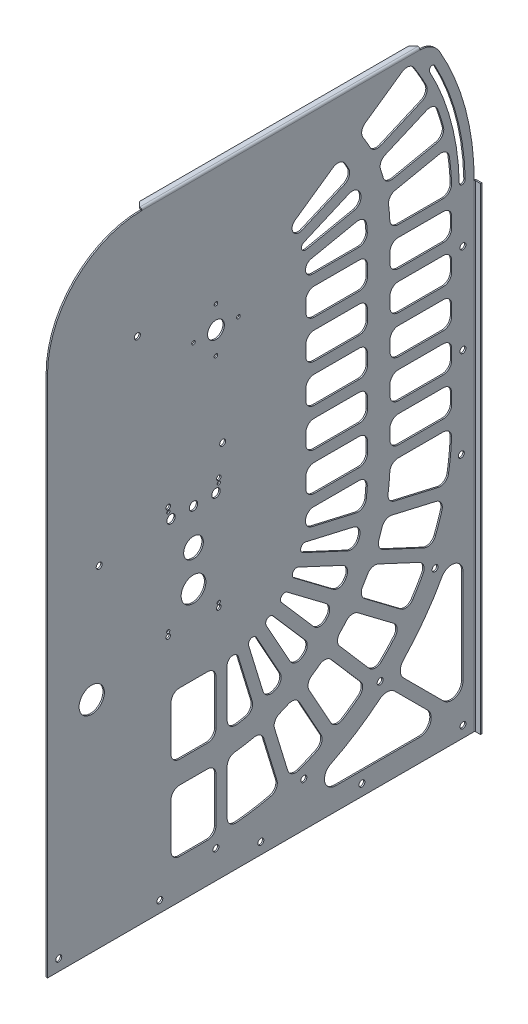
from build123d import *

# Parameters (mm, degrees)
SKETCH1_W             = 482.6
SKETCH1_H             = 698.5
BASE_FLANGE1_DEPTH    = 1.5875
SKETCH7_R             = 9.525
BEARING_HOLES_DEPTH   = 850.003845784
SKETCH9_R             = 3.3782
CUT_EXTRUDE2_DEPTH    = 850.003845784
CRVPATTERN1_START     = -1.5875
CRVPATTERN1_OUTLINE_R = 3.3782
CRVPATTERN1_DEPTH     = 1.5875
CUT_EXTRUDE3_DEPTH    = 850.003845784
CUT_EXTRUDE4_REACH    = 851.004
SKETCH12_R            = 4.7625
SKETCH13_R            = 3.3782
CUT_EXTRUDE5_DEPTH    = 850.003845784
CUT_EXTRUDE7_DEPTH    = 2.54
FILLET1_R             = 25.4
FILLET2_R             = 106.68
SKETCH26_R            = 3.3782
CUT_EXTRUDE9_DEPTH    = 850.003845784
CUT_EXTRUDE8_DEPTH    = 850.003845784
EDGE_FLANGE2_DEPTH    = 539.75
CUT_EXTRUDE10_DEPTH   = 850.039465459
SKETCH28_R            = 14.2875
CUT_EXTRUDE11_DEPTH   = 850.039465459
EDGE_FLANGE3_DEPTH    = 314.788975189
BREAK_CORNER1_START   = 699.2366
BREAK_CORNER1_DEPTH   = 1.5875


# Read off the part's stored shape, not the designer's step: CrvPattern1, Break-Corner1
# Sheet-metal steps are written as plain solids
with BuildPart() as part:
    # Sketch1 → Base-Flange1 (new body)
    with BuildSketch(Plane(origin=(0, 0, 0), x_dir=(0, 0, -1), z_dir=(1, 0, 0))):
        with Locations((-241.3, 349.25)):
            Rectangle(SKETCH1_W, SKETCH1_H)
    extrude(amount=-BASE_FLANGE1_DEPTH)

    # Sketch7 → Bearing Holes (cut, through all)
    with BuildSketch(Plane(origin=(0, 0, 0), x_dir=(0, 0, -1), z_dir=(1, 0, 0))):
        with Locations((-292.1, 539.75)):
            Circle(SKETCH7_R)
        with BuildLine():
            ThreePointArc((-315.4807, 539.75), (-317.5, 541.7693), (-319.5193, 539.75))
            ThreePointArc((-319.5193, 539.75), (-317.5, 537.7307), (-315.4807, 539.75))
        make_face()
        with BuildLine():
            ThreePointArc((-294.1193, 514.35), (-292.1, 512.3307), (-290.0807, 514.35))
            ThreePointArc((-290.0807, 514.35), (-292.1, 516.3693), (-294.1193, 514.35))
        make_face()
        with BuildLine():
            ThreePointArc((-268.7193, 539.75), (-266.7, 537.7307), (-264.6807, 539.75))
            ThreePointArc((-264.6807, 539.75), (-266.7, 541.7693), (-268.7193, 539.75))
        make_face()
        with BuildLine():
            ThreePointArc((-294.1193, 565.15), (-292.1, 563.1307), (-290.0807, 565.15))
            ThreePointArc((-290.0807, 565.15), (-292.1, 567.1693), (-294.1193, 565.15))
        make_face()
    extrude(amount=-BEARING_HOLES_DEPTH, mode=Mode.SUBTRACT)

    # Sketch9 → Cut-Extrude2 (cut, through all)
    with BuildSketch(Plane(origin=(0, 0, 0), x_dir=(0, 0, -1), z_dir=(1, 0, 0))):
        with Locations((-292.1, 31.75)):
            Circle(SKETCH9_R)
    extrude(amount=-CUT_EXTRUDE2_DEPTH, mode=Mode.SUBTRACT)

    # CrvPattern1 outline → CrvPattern1 (cut)
    with BuildSketch(Plane.YZ.offset(CRVPATTERN1_START)):
        with Locations((481.869506294, 12.7)):
            Circle(CRVPATTERN1_OUTLINE_R)
        with Locations((380.269506294, 12.7)):
            Circle(CRVPATTERN1_OUTLINE_R)
        with Locations((278.74261521, 14.58581764)):
            Circle(CRVPATTERN1_OUTLINE_R)
        with Locations((182.156845096, 44.259071201)):
            Circle(CRVPATTERN1_OUTLINE_R)
        with Locations((102.440892256, 106.345139108)):
            Circle(CRVPATTERN1_OUTLINE_R)
        with Locations((50.020066151, 192.724360892)):
            Circle(CRVPATTERN1_OUTLINE_R)
    extrude(amount=CRVPATTERN1_DEPTH, mode=Mode.SUBTRACT)

    # Sketch11 → Cut-Extrude3 (cut, through all)
    with BuildSketch(Plane(origin=(0, 0, 0), x_dir=(0, 0, -1), z_dir=(1, 0, 0))):
        with BuildLine():
            ThreePointArc((-10.148177306, 546.176984789), (-19.619450406, 612.499477987), (-44.466941645, 674.716680569))
            ThreePointArc((-44.466941645, 674.716680569), (-49.04986212, 676.066239905), (-50.399421456, 671.483319431))
            ThreePointArc((-50.399421456, 671.483319431), (-26.147195006, 610.756637946), (-16.902822694, 546.023015211))
            ThreePointArc((-16.902822694, 546.023015211), (-13.448515211, 542.722677306), (-10.148177306, 546.176984789))
        make_face()
    extrude(amount=-CUT_EXTRUDE3_DEPTH, mode=Mode.SUBTRACT)

    # Sketch12 → Cut-Extrude4 (cut, up to next)
    with BuildSketch(Plane(origin=(0, 0, 0), x_dir=(0, 0, -1), z_dir=(1, 0, 0)), mode=Mode.PRIVATE) as cut_extrude4_sk1:
        with Locations((-342.9, 379.8824)):
            Circle(SKETCH12_R)
    cut_extrude4_tool1 = extrude(cut_extrude4_sk1.sketch, amount=-CUT_EXTRUDE4_REACH, mode=Mode.PRIVATE) & part.part
    # Sketch12 → Cut-Extrude4 (cut, up to next)
    with BuildSketch(Plane(origin=(0, 0, 0), x_dir=(0, 0, -1), z_dir=(1, 0, 0)), mode=Mode.PRIVATE) as cut_extrude4_sk2:
        with Locations((-292.1, 379.8824)):
            Circle(SKETCH12_R)
    cut_extrude4_tool2 = extrude(cut_extrude4_sk2.sketch, amount=-CUT_EXTRUDE4_REACH, mode=Mode.PRIVATE) & part.part
    # Sketch12 → Cut-Extrude4 (cut, up to next)
    with BuildSketch(Plane(origin=(0, 0, 0), x_dir=(0, 0, -1), z_dir=(1, 0, 0)), mode=Mode.PRIVATE) as cut_extrude4_sk3:
        with Locations((-317.5, 379.8824)):
            Circle(SKETCH12_R)
    cut_extrude4_tool3 = extrude(cut_extrude4_sk3.sketch, amount=-CUT_EXTRUDE4_REACH, mode=Mode.PRIVATE) & part.part
    # Sketch12 → Cut-Extrude4 (cut, up to next)
    with BuildSketch(Plane(origin=(0, 0, 0), x_dir=(0, 0, -1), z_dir=(1, 0, 0)), mode=Mode.PRIVATE) as cut_extrude4_sk4:
        with BuildLine():
            ThreePointArc((-347.896015918, 388.0612), (-346.075, 386.240184083), (-344.253984083, 388.0612))
            ThreePointArc((-344.253984083, 388.0612), (-346.075, 389.882215918), (-347.896015918, 388.0612))
        make_face()
    cut_extrude4_tool4 = extrude(cut_extrude4_sk4.sketch, amount=-CUT_EXTRUDE4_REACH, mode=Mode.PRIVATE) & part.part
    # Sketch12 → Cut-Extrude4 (cut, up to next)
    with BuildSketch(Plane(origin=(0, 0, 0), x_dir=(0, 0, -1), z_dir=(1, 0, 0)), mode=Mode.PRIVATE) as cut_extrude4_sk5:
        with BuildLine():
            ThreePointArc((-348.6277, 393.1412), (-346.075, 390.5885), (-343.5223, 393.1412))
            ThreePointArc((-343.5223, 393.1412), (-346.075, 395.6939), (-348.6277, 393.1412))
        make_face()
    cut_extrude4_tool5 = extrude(cut_extrude4_sk5.sketch, amount=-CUT_EXTRUDE4_REACH, mode=Mode.PRIVATE) & part.part
    # Sketch12 → Cut-Extrude4 (cut, up to next)
    with BuildSketch(Plane(origin=(0, 0, 0), x_dir=(0, 0, -1), z_dir=(1, 0, 0)), mode=Mode.PRIVATE) as cut_extrude4_sk6:
        with BuildLine():
            ThreePointArc((-344.253984082, 271.2212), (-346.075, 273.042215918), (-347.896015918, 271.2212))
            ThreePointArc((-347.896015918, 271.2212), (-346.075, 269.400184083), (-344.253984082, 271.2212))
        make_face()
    cut_extrude4_tool6 = extrude(cut_extrude4_sk6.sketch, amount=-CUT_EXTRUDE4_REACH, mode=Mode.PRIVATE) & part.part
    # Sketch12 → Cut-Extrude4 (cut, up to next)
    with BuildSketch(Plane(origin=(0, 0, 0), x_dir=(0, 0, -1), z_dir=(1, 0, 0)), mode=Mode.PRIVATE) as cut_extrude4_sk7:
        with BuildLine():
            ThreePointArc((-343.5223, 266.1412), (-346.075, 268.6939), (-348.6277, 266.1412))
            ThreePointArc((-348.6277, 266.1412), (-346.075, 263.5885), (-343.5223, 266.1412))
        make_face()
    cut_extrude4_tool7 = extrude(cut_extrude4_sk7.sketch, amount=-CUT_EXTRUDE4_REACH, mode=Mode.PRIVATE) & part.part
    # Sketch12 → Cut-Extrude4 (cut, up to next)
    with BuildSketch(Plane(origin=(0, 0, 0), x_dir=(0, 0, -1), z_dir=(1, 0, 0)), mode=Mode.PRIVATE) as cut_extrude4_sk8:
        with BuildLine():
            ThreePointArc((-287.103984082, 271.2212), (-288.925, 273.042215918), (-290.746015918, 271.2212))
            ThreePointArc((-290.746015918, 271.2212), (-288.925, 269.400184083), (-287.103984082, 271.2212))
        make_face()
    cut_extrude4_tool8 = extrude(cut_extrude4_sk8.sketch, amount=-CUT_EXTRUDE4_REACH, mode=Mode.PRIVATE) & part.part
    # Sketch12 → Cut-Extrude4 (cut, up to next)
    with BuildSketch(Plane(origin=(0, 0, 0), x_dir=(0, 0, -1), z_dir=(1, 0, 0)), mode=Mode.PRIVATE) as cut_extrude4_sk9:
        with BuildLine():
            ThreePointArc((-291.4777, 266.1412), (-288.925, 263.5885), (-286.3723, 266.1412))
            ThreePointArc((-286.3723, 266.1412), (-288.925, 268.6939), (-291.4777, 266.1412))
        make_face()
    cut_extrude4_tool9 = extrude(cut_extrude4_sk9.sketch, amount=-CUT_EXTRUDE4_REACH, mode=Mode.PRIVATE) & part.part
    # Sketch12 → Cut-Extrude4 (cut, up to next)
    with BuildSketch(Plane(origin=(0, 0, 0), x_dir=(0, 0, -1), z_dir=(1, 0, 0)), mode=Mode.PRIVATE) as cut_extrude4_sk10:
        with BuildLine():
            ThreePointArc((-286.3723, 393.1412), (-288.925, 395.6939), (-291.4777, 393.1412))
            ThreePointArc((-291.4777, 393.1412), (-288.925, 390.5885), (-286.3723, 393.1412))
        make_face()
    cut_extrude4_tool10 = extrude(cut_extrude4_sk10.sketch, amount=-CUT_EXTRUDE4_REACH, mode=Mode.PRIVATE) & part.part
    # Sketch12 → Cut-Extrude4 (cut, up to next)
    with BuildSketch(Plane(origin=(0, 0, 0), x_dir=(0, 0, -1), z_dir=(1, 0, 0)), mode=Mode.PRIVATE) as cut_extrude4_sk11:
        with BuildLine():
            ThreePointArc((-290.746015918, 388.0612), (-288.925, 386.240184083), (-287.103984083, 388.0612))
            ThreePointArc((-287.103984083, 388.0612), (-288.925, 389.882215918), (-290.746015918, 388.0612))
        make_face()
    cut_extrude4_tool11 = extrude(cut_extrude4_sk11.sketch, amount=-CUT_EXTRUDE4_REACH, mode=Mode.PRIVATE) & part.part
    # Sketch12 → Cut-Extrude4 (cut, up to next)
    with BuildSketch(Plane(origin=(0, 0, 0), x_dir=(0, 0, -1), z_dir=(1, 0, 0)), mode=Mode.PRIVATE) as cut_extrude4_sk12:
        with BuildLine():
            ThreePointArc((-303.576766112, 297.307871241), (-316.357871241, 312.373233888), (-331.423233888, 299.592128759))
            ThreePointArc((-331.423233888, 299.592128759), (-318.642128759, 284.526766112), (-303.576766112, 297.307871241))
        make_face()
    cut_extrude4_tool12 = extrude(cut_extrude4_sk12.sketch, amount=-CUT_EXTRUDE4_REACH, mode=Mode.PRIVATE) & part.part
    # Sketch12 → Cut-Extrude4 (cut, up to next)
    with BuildSketch(Plane(origin=(0, 0, 0), x_dir=(0, 0, -1), z_dir=(1, 0, 0)), mode=Mode.PRIVATE) as cut_extrude4_sk13:
        with BuildLine():
            ThreePointArc((-328.448691084, 341.081764815), (-319.415564815, 328.217508917), (-306.551308917, 337.250635185))
            ThreePointArc((-306.551308917, 337.250635185), (-315.584435185, 350.114891084), (-328.448691084, 341.081764815))
        make_face()
    cut_extrude4_tool13 = extrude(cut_extrude4_sk13.sketch, amount=-CUT_EXTRUDE4_REACH, mode=Mode.PRIVATE) & part.part
    add(cut_extrude4_tool1.solids().sort_by_distance((0, 379.8824, 342.9))[0], mode=Mode.SUBTRACT)
    add(cut_extrude4_tool2.solids().sort_by_distance((0, 379.8824, 292.1))[0], mode=Mode.SUBTRACT)
    add(cut_extrude4_tool3.solids().sort_by_distance((0, 379.8824, 317.5))[0], mode=Mode.SUBTRACT)
    add(cut_extrude4_tool4.solids().sort_by_distance((0, 388.0612, 346.075))[0], mode=Mode.SUBTRACT)
    add(cut_extrude4_tool5.solids().sort_by_distance((0, 393.1412, 346.075))[0], mode=Mode.SUBTRACT)
    add(cut_extrude4_tool6.solids().sort_by_distance((0, 271.2212, 346.075))[0], mode=Mode.SUBTRACT)
    add(cut_extrude4_tool7.solids().sort_by_distance((0, 266.1412, 346.075))[0], mode=Mode.SUBTRACT)
    add(cut_extrude4_tool8.solids().sort_by_distance((0, 271.2212, 288.925))[0], mode=Mode.SUBTRACT)
    add(cut_extrude4_tool9.solids().sort_by_distance((0, 266.1412, 288.925))[0], mode=Mode.SUBTRACT)
    add(cut_extrude4_tool10.solids().sort_by_distance((0, 393.1412, 288.925))[0], mode=Mode.SUBTRACT)
    add(cut_extrude4_tool11.solids().sort_by_distance((0, 388.0612, 288.925))[0], mode=Mode.SUBTRACT)
    add(cut_extrude4_tool12.solids().sort_by_distance((0, 298.45, 317.5))[0], mode=Mode.SUBTRACT)
    add(cut_extrude4_tool13.solids().sort_by_distance((0, 339.1662, 317.5))[0], mode=Mode.SUBTRACT)

    # Sketch13 → Cut-Extrude5 (cut, through all)
    with BuildSketch(Plane.ZY.offset(1.5875)):
        with Locations((381, 577.85)):
            Circle(SKETCH13_R)
        with Locations((284.48, 425.45)):
            Circle(SKETCH13_R)
        with Locations((424.18, 374.65)):
            Circle(SKETCH13_R)
    extrude(amount=-CUT_EXTRUDE5_DEPTH, mode=Mode.SUBTRACT)

    # Sketch18 → Cut-Extrude7 (cut)
    with BuildSketch(Plane(origin=(0, 0, 0), x_dir=(0, 0, -1), z_dir=(1, 0, 0))):
        with BuildLine():
            Line((-46.904470881, 698.5), (0, 698.5))
            Line((0, 698.5), (0, 539.75))
            ThreePointArc((0, 539.75), (-11.971436608, 622.517130989), (-46.904470881, 698.5))
        make_face()
    extrude(amount=-CUT_EXTRUDE7_DEPTH, mode=Mode.SUBTRACT)

    # Fillet1
    fillet1_edges = [part.edges().sort_by_distance(p)[0] for p in [
        (-0.79375, 698.5, 46.904470881),
    ]]
    fillet(fillet1_edges, radius=FILLET1_R)

    # Fillet2
    fillet2_edges = [part.edges().sort_by_distance(p)[0] for p in [
        (-0.79375, 698.5, 482.6),
    ]]
    fillet(fillet2_edges, radius=FILLET2_R)

    # Sketch26 → Cut-Extrude9 (cut, through all)
    with BuildSketch(Plane.ZY.offset(1.5875)):
        with Locations((12.7, 12.7)):
            Circle(SKETCH26_R)
        with Locations((127, 12.7)):
            Circle(SKETCH26_R)
        with Locations((241.3, 12.7)):
            Circle(SKETCH26_R)
        with Locations((355.6, 12.7)):
            Circle(SKETCH26_R)
        with Locations((469.9, 12.7)):
            Circle(SKETCH26_R)
    extrude(amount=-CUT_EXTRUDE9_DEPTH, mode=Mode.SUBTRACT)

    # Sketch19 → Cut-Extrude8 (cut, through all)
    with BuildSketch(Plane(origin=(0, 0, 0), x_dir=(0, 0, -1), z_dir=(1, 0, 0))):
        with BuildLine():
            Line((-156.649870801, 25.4), (-61.321024484, 25.4))
            ThreePointArc((-61.321024484, 25.4), (-49.587754421, 33.239920409), (-52.340768363, 47.080256121))
            Line((-52.340768363, 47.080256121), (-89.767936864, 84.507424621))
            ThreePointArc((-89.767936864, 84.507424621), (-98.124730264, 88.211855892), (-106.804518277, 85.34478648))
            ThreePointArc((-106.804518277, 85.34478648), (-133.53166182, 65.836950761), (-162.293626184, 49.477083333))
            ThreePointArc((-162.293626184, 49.477083333), (-169.014719331, 35.2016348), (-156.649870801, 25.4))
        make_face()
        with BuildLine():
            Line((-12.7, 163.589334509), (-12.7, 56.060512242))
            ThreePointArc((-12.7, 56.060512242), (-20.539920409, 44.327242179), (-34.380256121, 47.080256121))
            Line((-34.380256121, 47.080256121), (-79.827050366, 92.527050366))
            ThreePointArc((-79.827050366, 92.527050366), (-83.545642238, 101.336251972), (-80.065677818, 110.242418717))
            ThreePointArc((-80.065677818, 110.242418717), (-56.404297585, 138.610306414), (-36.5125, 169.737695572))
            ThreePointArc((-36.5125, 169.737695572), (-22.225, 175.886056634), (-12.7, 163.589334509))
        make_face()
    extrude(amount=-CUT_EXTRUDE8_DEPTH, mode=Mode.SUBTRACT)

    # Edge-Flange2 section (across the edge) → Edge-Flange2 (add)
    with BuildSketch(Plane(origin=(0, 0, -0.7366), x_dir=(0, 0, 1), z_dir=(0, 1, 0))):
        with BuildLine():
            Line((-1.5875, 0.7366), (-1.5875, 6.35))
            Line((-1.5875, 6.35), (0, 6.35))
            Line((0, 6.35), (0, 0.7366))
            ThreePointArc((0, 0.7366), (0.215745145, 0.215745145), (0.7366, 0))
            Line((0.7366, 0), (0.7366, -1.5875))
            ThreePointArc((0.7366, -1.5875), (-0.90678687, -0.90678687), (-1.5875, 0.7366))
        make_face()
    extrude(amount=EDGE_FLANGE2_DEPTH)

    # Sketch27 → Cut-Extrude10 (cut, through all)
    with BuildSketch(Plane.ZY.offset(1.5875)):
        with BuildLine():
            Line((333.375, 114.3), (301.625, 114.3))
            ThreePointArc((301.625, 114.3), (294.889807909, 111.510192091), (292.1, 104.775))
            Line((292.1, 104.775), (292.1, 53.975))
            ThreePointArc((292.1, 53.975), (294.889807909, 47.239807909), (301.625, 44.45))
            Line((301.625, 44.45), (333.375, 44.45))
            ThreePointArc((333.375, 44.45), (340.110192091, 47.239807909), (342.9, 53.975))
            Line((342.9, 53.975), (342.9, 104.775))
            ThreePointArc((342.9, 104.775), (340.110192091, 111.510192091), (333.375, 114.3))
        make_face()
        with BuildLine():
            Line((279.4, 54.937139277), (279.4, 105.975220848))
            ThreePointArc((279.4, 105.975220848), (276.963585082, 112.337420667), (270.900769231, 115.44482604))
            ThreePointArc((270.900769231, 115.44482604), (259.999148252, 116.935021646), (249.197819666, 119.032001305))
            ThreePointArc((249.197819666, 119.032001305), (242.329800372, 117.967696281), (238.013104914, 112.520809597))
            Line((238.013104914, 112.520809597), (223.125231873, 63.824771077))
            ThreePointArc((223.125231873, 63.824771077), (223.966051137, 56.31065229), (230.016776699, 51.776594685))
            ThreePointArc((230.016776699, 51.776594685), (249.416852344, 47.887699421), (269.051851852, 45.447774065))
            ThreePointArc((269.051851852, 45.447774065), (276.312590345, 47.916950137), (279.4, 54.937139277))
        make_face()
        with BuildLine():
            Line((210.980161472, 67.537891727), (225.868034514, 116.233930247))
            ThreePointArc((225.868034514, 116.233930247), (225.335192169, 123.163469428), (220.236497942, 127.886365932))
            ThreePointArc((220.236497942, 127.886365932), (215.184577357, 129.948619598), (210.191757295, 132.150105371))
            ThreePointArc((210.191757295, 132.150105371), (203.252539243, 132.53699947), (197.897702518, 128.10663178))
            Line((197.897702518, 128.10663178), (173.210689518, 83.570081393))
            ThreePointArc((173.210689518, 83.570081393), (172.470861722, 76.045347975), (177.44668083, 70.352353825))
            ThreePointArc((177.44668083, 70.352353825), (187.892008032, 65.651355584), (198.529557141, 61.403203778))
            ThreePointArc((198.529557141, 61.403203778), (206.081248809, 61.778585093), (210.980161472, 67.537891727))
        make_face()
        with BuildLine():
            Line((301.625, 139.7), (333.375, 139.7))
            ThreePointArc((333.375, 139.7), (340.110192091, 142.489807909), (342.9, 149.225))
            Line((342.9, 149.225), (342.9, 200.025))
            ThreePointArc((342.9, 200.025), (340.110192091, 206.760192091), (333.375, 209.55))
            Line((333.375, 209.55), (301.625, 209.55))
            ThreePointArc((301.625, 209.55), (294.889807909, 206.760192091), (292.1, 200.025))
            Line((292.1, 200.025), (292.1, 149.225))
            ThreePointArc((292.1, 149.225), (294.889807909, 142.489807909), (301.625, 139.7))
        make_face()
        with BuildLine():
            Line((279.4, 150.757497058), (279.4, 204.821575064))
            ThreePointArc((279.4, 204.821575064), (273.914615259, 211.187677432), (266.807647542, 206.703514748))
            Line((266.807647542, 206.703514748), (251.058315916, 155.189772161))
            ThreePointArc((251.058315916, 155.189772161), (251.986644049, 147.525847824), (258.288713935, 143.066986478))
            ThreePointArc((258.288713935, 143.066986478), (263.414918227, 142.116664283), (268.567647059, 141.322643944))
            ThreePointArc((268.567647059, 141.322643944), (276.130920725, 143.574943133), (279.4, 150.757497058))
        make_face()
        with BuildLine():
            Line((238.913245515, 158.902892811), (255.098677828, 211.843056471))
            ThreePointArc((255.098677828, 211.843056471), (252.401717345, 217.626706889), (246.367841235, 215.549076729))
            Line((246.367841235, 215.549076729), (219.529220513, 167.130923261))
            ThreePointArc((219.529220513, 167.130923261), (218.843842981, 159.441463788), (224.081148119, 153.769765254))
            ThreePointArc((224.081148119, 153.769765254), (225.109148021, 153.329442876), (226.139998169, 152.895835257))
            ThreePointArc((226.139998169, 152.895835257), (233.858014512, 153.068326087), (238.913245515, 158.902892811))
        make_face()
        with BuildLine():
            Line((162.103019238, 89.72716357), (186.790032238, 134.263713957))
            ThreePointArc((186.790032238, 134.263713957), (187.709565985, 141.152610234), (183.704235857, 146.832378255))
            ThreePointArc((183.704235857, 146.832378255), (179.191478504, 149.899920082), (174.76547817, 153.09136377))
            ThreePointArc((174.76547817, 153.09136377), (168.058338487, 154.912547862), (161.899392555, 151.692327494))
            Line((161.899392555, 151.692327494), (128.492180526, 113.261726202))
            ThreePointArc((128.492180526, 113.261726202), (126.204039694, 106.055245111), (129.887485176, 99.452125578))
            ThreePointArc((129.887485176, 99.452125578), (139.127164425, 92.682149788), (148.649017139, 86.31515947))
            ThreePointArc((148.649017139, 86.31515947), (156.11373239, 85.112252819), (162.103019238, 89.72716357))
        make_face()
        with BuildLine():
            Line((208.421550232, 173.288005439), (235.260170954, 221.706158906))
            ThreePointArc((235.260170954, 221.706158906), (233.824634067, 227.9241523), (227.490649026, 227.146436728))
            Line((227.490649026, 227.146436728), (191.171816407, 185.366399095))
            ThreePointArc((191.171816407, 185.366399095), (188.902687498, 177.987470761), (192.84633252, 171.350815482))
            ThreePointArc((192.84633252, 171.350815482), (193.760319988, 170.706382007), (194.678491494, 170.067923958))
            ThreePointArc((194.678491494, 170.067923958), (202.263713522, 168.631979621), (208.421550232, 173.288005439))
        make_face()
        with BuildLine():
            Line((118.907368857, 121.59367587), (152.314580886, 160.024277162))
            ThreePointArc((152.314580886, 160.024277162), (154.646302687, 166.57145271), (151.909388806, 172.959859133))
            ThreePointArc((151.909388806, 172.959859133), (148.133023836, 176.898622822), (144.467280681, 180.940543022))
            ThreePointArc((144.467280681, 180.940543022), (138.285353557, 184.116422624), (131.591473909, 182.247088659))
            Line((131.591473909, 182.247088659), (90.924118321, 151.602038149))
            ThreePointArc((90.924118321, 151.602038149), (87.187667188, 145.028767189), (89.417754803, 137.804110283))
            ThreePointArc((89.417754803, 137.804110283), (97.047967778, 129.261037371), (105.037973442, 121.05347657))
            ThreePointArc((105.037973442, 121.05347657), (112.089468399, 118.324854747), (118.907368857, 121.59367587))
        make_face()
        with BuildLine():
            Line((181.587004738, 193.698348764), (217.905837358, 235.478386396))
            ThreePointArc((217.905837358, 235.478386396), (217.794463915, 241.858966618), (211.437195486, 242.415155536))
            Line((211.437195486, 242.415155536), (167.22545823, 209.099221866))
            ThreePointArc((167.22545823, 209.099221866), (163.471749766, 202.353319248), (165.949378463, 195.041760905))
            ThreePointArc((165.949378463, 195.041760905), (166.709407857, 194.221381167), (167.474772221, 193.405976368))
            ThreePointArc((167.474772221, 193.405976368), (174.595689334, 190.424354523), (181.587004738, 193.698348764))
        make_face()
        with BuildLine():
            Line((83.281067527, 161.744709126), (123.948423115, 192.389759637))
            ThreePointArc((123.948423115, 192.389759637), (127.590425539, 198.309071468), (126.241544173, 205.126912276))
            ThreePointArc((126.241544173, 205.126912276), (123.366616857, 209.764754954), (120.621341448, 214.480500357))
            ThreePointArc((120.621341448, 214.480500357), (115.234806761, 218.872274291), (108.298548059, 218.435525594))
            Line((108.298548059, 218.435525594), (62.148407496, 196.915361625))
            ThreePointArc((62.148407496, 196.915361625), (57.126946905, 191.262584279), (57.806211122, 183.732142174))
            ThreePointArc((57.806211122, 183.732142174), (63.493480903, 173.789345421), (69.602437929, 164.099923929))
            ThreePointArc((69.602437929, 164.099923929), (75.932528426, 159.964840799), (83.281067527, 161.744709126))
        make_face()
        with BuildLine():
            Line((159.582407436, 219.241892843), (203.794144692, 252.557826514))
            ThreePointArc((203.794144692, 252.557826514), (205.011802249, 258.822131589), (198.909093565, 260.687916874))
            Line((198.909093565, 260.687916874), (148.736716744, 237.292153334))
            ThreePointArc((148.736716744, 237.292153334), (143.662483797, 231.474104748), (144.565811904, 223.807193525))
            ThreePointArc((144.565811904, 223.807193525), (145.138666295, 222.846722057), (145.71777342, 221.89000761))
            ThreePointArc((145.71777342, 221.89000761), (152.06316737, 217.493019439), (159.582407436, 219.241892843))
        make_face()
        with BuildLine():
            Line((56.781155572, 208.42547052), (102.931296135, 229.94563449))
            ThreePointArc((102.931296135, 229.94563449), (107.724406198, 234.978380274), (107.822509937, 241.927683108))
            ThreePointArc((107.822509937, 241.927683108), (105.974668393, 247.061908795), (104.269842439, 252.245378699))
            ThreePointArc((104.269842439, 252.245378699), (99.914117603, 257.66110537), (93.038627635, 258.676029955))
            Line((93.038627635, 258.676029955), (43.422684692, 247.221286956))
            ThreePointArc((43.422684692, 247.221286956), (37.335676568, 242.73605672), (36.434430281, 235.22894587))
            ThreePointArc((36.434430281, 235.22894587), (39.930195888, 224.320973206), (43.891113541, 213.573165236))
            ThreePointArc((43.891113541, 213.573165236), (49.223144248, 208.212343776), (56.781155572, 208.42547052))
        make_face()
        with BuildLine():
            Line((143.36946482, 248.80226223), (193.541841641, 272.198025769))
            ThreePointArc((193.541841641, 272.198025769), (196.035312719, 278.072275507), (190.453881436, 281.166113388))
            Line((190.453881436, 281.166113388), (136.51363867, 268.713027111))
            ThreePointArc((136.51363867, 268.713027111), (130.340649568, 264.077109197), (129.630197313, 256.389925906))
            ThreePointArc((129.630197313, 256.389925906), (129.990840213, 255.331339918), (130.35838034, 254.275128836))
            ThreePointArc((130.35838034, 254.275128836), (135.650926963, 248.654943821), (143.36946482, 248.80226223))
        make_face()
        with BuildLine():
            Line((40.565806302, 259.595786779), (90.181749245, 271.050529777))
            ThreePointArc((90.181749245, 271.050529777), (95.91648504, 274.976754374), (97.457286278, 281.753801353))
            ThreePointArc((97.457286278, 281.753801353), (96.195132975, 291.88330397), (95.459774496, 302.064615385))
            ThreePointArc((95.459774496, 302.064615385), (92.522853441, 308.513866436), (85.944924875, 311.15))
            Line((85.944924875, 311.15), (35.10144942, 311.15))
            ThreePointArc((35.10144942, 311.15), (28.242665515, 308.234289548), (25.582984584, 301.272222222))
            ThreePointArc((25.582984584, 301.272222222), (26.761442787, 284.236433609), (29.027708528, 267.310982448))
            ThreePointArc((29.027708528, 267.310982448), (33.128644118, 260.958716279), (40.565806302, 259.595786779))
        make_face()
        with BuildLine():
            Line((133.656760279, 281.087526934), (183.62473629, 292.62354317))
            ThreePointArc((183.62473629, 292.62354317), (190.837072188, 302.828762421), (181.513913161, 311.15))
            Line((181.513913161, 311.15), (130.455389821, 311.15))
            ThreePointArc((130.455389821, 311.15), (123.524934335, 308.159096094), (120.94688334, 301.064705882))
            ThreePointArc((120.94688334, 301.064705882), (121.403318948, 295.09554337), (122.067872162, 289.145954848))
            ThreePointArc((122.067872162, 289.145954848), (126.076261774, 282.548202043), (133.656760279, 281.087526934))
        make_face()
        with BuildLine():
            Line((130.175, 323.85), (180.975, 323.85))
            ThreePointArc((180.975, 323.85), (187.710192091, 326.639807909), (190.5, 333.375))
            Line((190.5, 333.375), (190.5, 344.805))
            ThreePointArc((190.5, 344.805), (187.710192091, 351.540192091), (180.975, 354.33))
            Line((180.975, 354.33), (130.175, 354.33))
            ThreePointArc((130.175, 354.33), (123.439807909, 351.540192091), (120.65, 344.805))
            Line((120.65, 344.805), (120.65, 333.375))
            ThreePointArc((120.65, 333.375), (123.439807909, 326.639807909), (130.175, 323.85))
        make_face()
        with BuildLine():
            Line((34.925, 323.85), (85.725, 323.85))
            ThreePointArc((85.725, 323.85), (92.460192091, 326.639807909), (95.25, 333.375))
            Line((95.25, 333.375), (95.25, 344.805))
            ThreePointArc((95.25, 344.805), (92.460192091, 351.540192091), (85.725, 354.33))
            Line((85.725, 354.33), (34.925, 354.33))
            ThreePointArc((34.925, 354.33), (28.189807909, 351.540192091), (25.4, 344.805))
            Line((25.4, 344.805), (25.4, 333.375))
            ThreePointArc((25.4, 333.375), (28.189807909, 326.639807909), (34.925, 323.85))
        make_face()
        with BuildLine():
            Line((95.25, 376.555), (95.25, 387.985))
            ThreePointArc((95.25, 387.985), (92.460192091, 394.720192091), (85.725, 397.51))
            Line((85.725, 397.51), (34.925, 397.51))
            ThreePointArc((34.925, 397.51), (28.189807909, 394.720192091), (25.4, 387.985))
            Line((25.4, 387.985), (25.4, 376.555))
            ThreePointArc((25.4, 376.555), (28.189807909, 369.819807909), (34.925, 367.03))
            Line((34.925, 367.03), (85.725, 367.03))
            ThreePointArc((85.725, 367.03), (92.460192091, 369.819807909), (95.25, 376.555))
        make_face()
        with BuildLine():
            Line((120.65, 387.985), (120.65, 376.555))
            ThreePointArc((120.65, 376.555), (123.439807909, 369.819807909), (130.175, 367.03))
            Line((130.175, 367.03), (180.975, 367.03))
            ThreePointArc((180.975, 367.03), (187.710192091, 369.819807909), (190.5, 376.555))
            Line((190.5, 376.555), (190.5, 387.985))
            ThreePointArc((190.5, 387.985), (187.710192091, 394.720192091), (180.975, 397.51))
            Line((180.975, 397.51), (130.175, 397.51))
            ThreePointArc((130.175, 397.51), (123.439807909, 394.720192091), (120.65, 387.985))
        make_face()
        with BuildLine():
            Line((95.25, 419.735), (95.25, 431.165))
            ThreePointArc((95.25, 431.165), (92.460192091, 437.900192091), (85.725, 440.69))
            Line((85.725, 440.69), (34.925, 440.69))
            ThreePointArc((34.925, 440.69), (28.189807909, 437.900192091), (25.4, 431.165))
            Line((25.4, 431.165), (25.4, 419.735))
            ThreePointArc((25.4, 419.735), (28.189807909, 412.999807909), (34.925, 410.21))
            Line((34.925, 410.21), (85.725, 410.21))
            ThreePointArc((85.725, 410.21), (92.460192091, 412.999807909), (95.25, 419.735))
        make_face()
        with BuildLine():
            Line((120.65, 431.165), (120.65, 419.735))
            ThreePointArc((120.65, 419.735), (123.439807909, 412.999807909), (130.175, 410.21))
            Line((130.175, 410.21), (180.975, 410.21))
            ThreePointArc((180.975, 410.21), (187.710192091, 412.999807909), (190.5, 419.735))
            Line((190.5, 419.735), (190.5, 431.165))
            ThreePointArc((190.5, 431.165), (187.710192091, 437.900192091), (180.975, 440.69))
            Line((180.975, 440.69), (130.175, 440.69))
            ThreePointArc((130.175, 440.69), (123.439807909, 437.900192091), (120.65, 431.165))
        make_face()
        with BuildLine():
            Line((95.25, 462.915), (95.25, 474.345))
            ThreePointArc((95.25, 474.345), (92.460192091, 481.080192091), (85.725, 483.87))
            Line((85.725, 483.87), (34.925, 483.87))
            ThreePointArc((34.925, 483.87), (28.189807909, 481.080192091), (25.4, 474.345))
            Line((25.4, 474.345), (25.4, 462.915))
            ThreePointArc((25.4, 462.915), (28.189807909, 456.179807909), (34.925, 453.39))
            Line((34.925, 453.39), (85.725, 453.39))
            ThreePointArc((85.725, 453.39), (92.460192091, 456.179807909), (95.25, 462.915))
        make_face()
        with BuildLine():
            Line((120.65, 474.345), (120.65, 462.915))
            ThreePointArc((120.65, 462.915), (123.439807909, 456.179807909), (130.175, 453.39))
            Line((130.175, 453.39), (180.975, 453.39))
            ThreePointArc((180.975, 453.39), (187.710192091, 456.179807909), (190.5, 462.915))
            Line((190.5, 462.915), (190.5, 474.345))
            ThreePointArc((190.5, 474.345), (187.710192091, 481.080192091), (180.975, 483.87))
            Line((180.975, 483.87), (130.175, 483.87))
            ThreePointArc((130.175, 483.87), (123.439807909, 481.080192091), (120.65, 474.345))
        make_face()
        with BuildLine():
            Line((95.25, 506.095), (95.25, 517.525))
            ThreePointArc((95.25, 517.525), (92.460192091, 524.260192091), (85.725, 527.05))
            Line((85.725, 527.05), (34.925, 527.05))
            ThreePointArc((34.925, 527.05), (28.189807909, 524.260192091), (25.4, 517.525))
            Line((25.4, 517.525), (25.4, 506.095))
            ThreePointArc((25.4, 506.095), (28.189807909, 499.359807909), (34.925, 496.57))
            Line((34.925, 496.57), (85.725, 496.57))
            ThreePointArc((85.725, 496.57), (92.460192091, 499.359807909), (95.25, 506.095))
        make_face()
        with BuildLine():
            Line((120.65, 517.525), (120.65, 506.095))
            ThreePointArc((120.65, 506.095), (123.439807909, 499.359807909), (130.175, 496.57))
            Line((130.175, 496.57), (180.975, 496.57))
            ThreePointArc((180.975, 496.57), (187.710192091, 499.359807909), (190.5, 506.095))
            Line((190.5, 506.095), (190.5, 517.525))
            ThreePointArc((190.5, 517.525), (187.710192091, 524.260192091), (180.975, 527.05))
            Line((180.975, 527.05), (130.175, 527.05))
            ThreePointArc((130.175, 527.05), (123.439807909, 524.260192091), (120.65, 517.525))
        make_face()
        with BuildLine():
            Line((35.10144942, 539.75), (85.944924875, 539.75))
            ThreePointArc((85.944924875, 539.75), (92.522853441, 542.386133564), (95.459774496, 548.835384615))
            ThreePointArc((95.459774496, 548.835384615), (95.984221037, 556.735986629), (96.825968646, 564.609106553))
            ThreePointArc((96.825968646, 564.609106553), (95.127889782, 571.34846575), (89.303347569, 575.140185969))
            Line((89.303347569, 575.140185969), (39.434298666, 585.437316283))
            ThreePointArc((39.434298666, 585.437316283), (32.030864105, 583.901700806), (28.078849485, 577.455730078))
            ThreePointArc((28.078849485, 577.455730078), (26.466257585, 563.574459918), (25.582984584, 549.627777778))
            ThreePointArc((25.582984584, 549.627777778), (28.242665515, 542.665710452), (35.10144942, 539.75))
        make_face()
        with BuildLine():
            Line((130.455389821, 539.75), (182.834293733, 539.75))
            ThreePointArc((182.834293733, 539.75), (190.747995805, 546.896398191), (184.442913191, 555.49544586))
            Line((184.442913191, 555.49544586), (133.00013781, 566.117524553))
            ThreePointArc((133.00013781, 566.117524553), (125.455680177, 564.480854646), (121.601898694, 557.791617198))
            ThreePointArc((121.601898694, 557.791617198), (121.228075876, 553.817268616), (120.94688334, 549.835294118))
            ThreePointArc((120.94688334, 549.835294118), (123.524934335, 542.740903906), (130.455389821, 539.75))
        make_face()
        with BuildLine():
            Line((135.568300978, 578.55515045), (190.086242045, 567.298101119))
            ThreePointArc((190.086242045, 567.298101119), (195.202357804, 570.30170923), (192.734279957, 575.696604399))
            Line((192.734279957, 575.696604399), (141.619018843, 597.745575781))
            ThreePointArc((141.619018843, 597.745575781), (133.899461599, 597.668340364), (128.772615488, 591.896600737))
            ThreePointArc((128.772615488, 591.896600737), (128.585228794, 591.306009325), (128.39997767, 590.71474457))
            ThreePointArc((128.39997767, 590.71474457), (129.289110296, 583.046174134), (135.568300978, 578.55515045))
        make_face()
        with BuildLine():
            Line((146.649231872, 609.406920338), (194.881260533, 588.601654035))
            ThreePointArc((194.881260533, 588.601654035), (204.978292963, 592.029134696), (202.594773341, 602.422234416))
            Line((202.594773341, 602.422234416), (159.688487123, 632.465539462))
            ThreePointArc((159.688487123, 632.465539462), (152.295878341, 633.990680373), (146.114887542, 629.658005431))
            ThreePointArc((146.114887542, 629.658005431), (144.061260241, 626.234877467), (142.08788527, 622.764865742))
            ThreePointArc((142.08788527, 622.764865742), (141.407929272, 615.074924962), (146.649231872, 609.406920338))
        make_face()
        with BuildLine():
            Line((58.92320617, 647.248234028), (105.679730836, 627.079438021))
            ThreePointArc((105.679730836, 627.079438021), (112.625757868, 626.844613224), (117.882280272, 631.391195064))
            ThreePointArc((117.882280272, 631.391195064), (121.708597066, 638.323283938), (125.810594758, 645.095888407))
            ThreePointArc((125.810594758, 645.095888407), (127.103948308, 652.063354302), (123.22764877, 657.995693326))
            Line((123.22764877, 657.995693326), (81.579111913, 687.158312789))
            ThreePointArc((81.579111913, 687.158312789), (74.288342245, 688.703939442), (68.116381407, 684.526478069))
            ThreePointArc((68.116381407, 684.526478069), (60.840428051, 672.595400304), (54.199416532, 660.299584759))
            ThreePointArc((54.199416532, 660.299584759), (53.739460468, 652.752572198), (58.92320617, 647.248234028))
        make_face()
        with BuildLine():
            Line((42.002461834, 597.874942179), (91.871510738, 587.577811866))
            ThreePointArc((91.871510738, 587.577811866), (98.721522871, 588.752447127), (102.950050048, 594.268060613))
            ThreePointArc((102.950050048, 594.268060613), (104.360818245, 598.943936632), (105.887156896, 603.583373428))
            ThreePointArc((105.887156896, 603.583373428), (105.586976142, 610.526883039), (100.649517808, 615.418093463))
            Line((100.649517808, 615.418093463), (53.892993141, 635.586889471))
            ThreePointArc((53.892993141, 635.586889471), (46.331980502, 635.580103418), (41.158123495, 630.06646924))
            ThreePointArc((41.158123495, 630.06646924), (37.743689235, 619.948236728), (34.737050292, 609.701426846))
            ThreePointArc((34.737050292, 609.701426846), (35.812735194, 602.217319673), (42.002461834, 597.874942179))
        make_face()
    extrude(amount=-CUT_EXTRUDE10_DEPTH, mode=Mode.SUBTRACT)

    # Sketch28 → Cut-Extrude11 (cut, through all)
    with BuildSketch(Plane.ZY.offset(1.5875)):
        with Locations((432.643923389, 247.65)):
            Circle(SKETCH28_R)
    extrude(amount=-CUT_EXTRUDE11_DEPTH, mode=Mode.SUBTRACT)

    # Edge-Flange3 section (across the edge) → Edge-Flange3 (add)
    with BuildSketch(Plane(origin=(-1.5875, 699.2366, 375.92), x_dir=(0, -1, 0), z_dir=(0, 0, -1))):
        with BuildLine():
            Line((-1.5875, 0.7366), (-1.5875, 6.35))
            Line((-1.5875, 6.35), (0, 6.35))
            Line((0, 6.35), (0, 0.7366))
            ThreePointArc((0, 0.7366), (0.215745145, 0.215745145), (0.7366, 0))
            Line((0.7366, 0), (0.7366, -1.5875))
            ThreePointArc((0.7366, -1.5875), (-0.90678687, -0.90678687), (-1.5875, 0.7366))
        make_face()
    extrude(amount=EDGE_FLANGE3_DEPTH)

    # Break-Corner1 outline → Break-Corner1 (cut)
    with BuildSketch(Plane(origin=(0, 0, 0), x_dir=(1, 0, 0), z_dir=(0, 1, 0)).offset(BREAK_CORNER1_START)):
        Polygon((-7.9375, -375.92), (-2.8575, -375.92), (-7.9375, -370.84), align=None)
        Polygon((-7.9375, -61.131024811), (-7.9375, -66.211024811), (-2.8575, -61.131024811), align=None)
    extrude(amount=BREAK_CORNER1_DEPTH, mode=Mode.SUBTRACT)


solid = part.part
